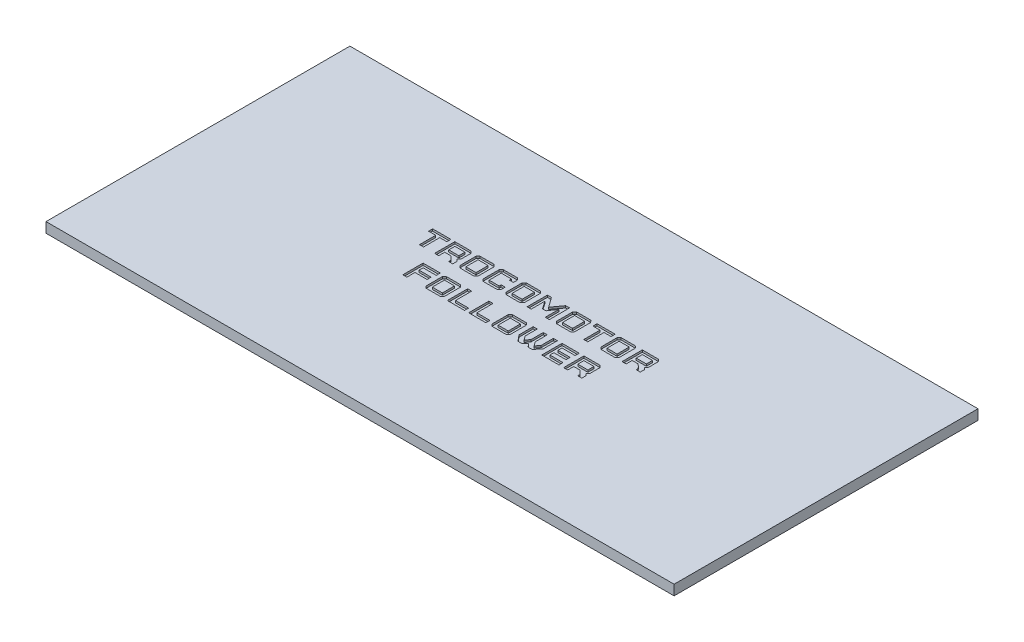
from build123d import *

# Parameters (mm, degrees)
SKETCH1_W           = 310
SKETCH1_H           = 150
BOSS_EXTRUDE1_DEPTH = 5
SKETCH2_W           = 4.98553719
SKETCH2_H           = 3.012396695
SKETCH2_H_2         = 5.995867769
SKETCH2_W_2         = 4.985537191
CUT_EXTRUDE1_DEPTH  = 1


with BuildPart() as part:
    # Sketch1 → Boss-Extrude1 (new body)
    with BuildSketch(Plane(origin=(0, 0, 0), x_dir=(1, 0, 0), z_dir=(0, 1, 0))):
        Rectangle(SKETCH1_W, SKETCH1_H)
    extrude(amount=BOSS_EXTRUDE1_DEPTH)

    # Sketch2 → Cut-Extrude1 (cut)
    # profile 1 of 18: a face of its own
    with BuildSketch(Plane(origin=(0, 5, 0), x_dir=(1, 0, 0), z_dir=(0, 1, 0))):
        Polygon((-50.972727273, 7.311112148), (-52.966528926, 7.311112148), (-52.966528926, 15.309046033), (-56.468595041, 15.309046033), (-56.468595041, 17.311112148), (-47.499586777, 17.311112148), (-47.499586777, 15.309046033), (-50.972727273, 15.309046033), align=None)
    # profile 2 of 18: a face of its own
    with BuildSketch(Plane(origin=(0, 5, 0), x_dir=(1, 0, 0), z_dir=(0, 1, 0))):
        Polygon((-36.54214876, 7.311112148), (-38.529752066, 7.311112148), (-38.529752066, 8.294583223), (-39.52768595, 9.313178264), (-40.531818182, 10.296649338), (-43.515289256, 10.296649338), (-43.515289256, 7.311112148), (-45.517355372, 7.311112148), (-45.517355372, 17.311112148), (-37.531818182, 17.311112148), (-36.54214876, 16.292517107), (-36.54214876, 11.292517107), (-37.531818182, 10.296649338), (-36.54214876, 9.313178264), align=None)
        with Locations((-41.022520661, 13.802847686)):
            Rectangle(SKETCH2_W, SKETCH2_H, mode=Mode.SUBTRACT)
    # profile 3 of 18: a face of its own
    with BuildSketch(Plane(origin=(0, 5, 0), x_dir=(1, 0, 0), z_dir=(0, 1, 0))):
        Polygon((-26.080578512, 7.311112148), (-33.074380165, 7.311112148), (-34.066115702, 8.294583223), (-34.066115702, 16.292517107), (-33.074380165, 17.311112148), (-26.080578512, 17.311112148), (-25.090909091, 16.292517107), (-25.090909091, 8.294583223), align=None)
        with Locations((-29.571280992, 12.311112149)):
            Rectangle(SKETCH2_W, SKETCH2_H_2, mode=Mode.SUBTRACT)
    # profile 4 of 18: a face of its own
    with BuildSketch(Plane(origin=(0, 5, 0), x_dir=(1, 0, 0), z_dir=(0, 1, 0))):
        Polygon((-14.629338843, 7.311112148), (-21.623140496, 7.311112148), (-22.614876033, 8.294583223), (-22.614876033, 16.292517107), (-21.623140496, 17.311112148), (-14.629338843, 17.311112148), (-13.639669421, 16.292517107), (-13.639669421, 14.313178264), (-15.627272727, 14.313178264), (-15.627272727, 15.309046033), (-20.612809917, 15.309046033), (-20.612809917, 9.313178264), (-15.627272727, 9.313178264), (-15.627272727, 10.296649338), (-13.639669421, 10.296649338), (-13.639669421, 8.294583223), align=None)
    # profile 5 of 18: a face of its own
    with BuildSketch(Plane(origin=(0, 5, 0), x_dir=(1, 0, 0), z_dir=(0, 1, 0))):
        Polygon((-3.310330579, 7.311112148), (-10.304132231, 7.311112148), (-11.295867769, 8.294583223), (-11.295867769, 16.292517107), (-10.304132231, 17.311112148), (-3.310330579, 17.311112148), (-2.320661157, 16.292517107), (-2.320661157, 8.294583223), align=None)
        with Locations((-6.801033058, 12.311112149)):
            Rectangle(SKETCH2_W, SKETCH2_H_2, mode=Mode.SUBTRACT)
    # profile 6 of 18: a face of its own
    with BuildSketch(Plane(origin=(0, 5, 0), x_dir=(1, 0, 0), z_dir=(0, 1, 0))):
        Polygon((2.157438017, 7.311112148), (0.155371901, 7.311112148), (0.155371901, 17.311112148), (2.157438017, 17.311112148), (5.642975207, 12.46400471), (9.186363636, 17.311112148), (11.109917355, 17.311112148), (11.109917355, 7.311112148), (9.109917355, 7.311112148), (9.109917355, 14.054913801), (6.502479339, 10.211938594), (4.82892562, 10.211938594), (2.157438017, 14.054913801), align=None)
    # profile 7 of 18: a face of its own
    with BuildSketch(Plane(origin=(0, 5, 0), x_dir=(1, 0, 0), z_dir=(0, 1, 0))):
        Polygon((21.575619835, 7.311112148), (14.581818182, 7.311112148), (13.590082645, 8.294583223), (13.590082645, 16.292517107), (14.581818182, 17.311112148), (21.575619835, 17.311112148), (22.565289256, 16.292517107), (22.565289256, 8.294583223), align=None)
        with Locations((18.084917355, 12.311112149)):
            Rectangle(SKETCH2_W, SKETCH2_H_2, mode=Mode.SUBTRACT)
    # profile 8 of 18: a face of its own
    with BuildSketch(Plane(origin=(0, 5, 0), x_dir=(1, 0, 0), z_dir=(0, 1, 0))):
        Polygon((30.111570248, 7.311112148), (28.117768595, 7.311112148), (28.117768595, 15.309046033), (24.615702479, 15.309046033), (24.615702479, 17.311112148), (33.584710744, 17.311112148), (33.584710744, 15.309046033), (30.111570248, 15.309046033), align=None)
    # profile 9 of 18: a face of its own
    with BuildSketch(Plane(origin=(0, 5, 0), x_dir=(1, 0, 0), z_dir=(0, 1, 0))):
        Polygon((43.552479339, 7.311112148), (36.558677686, 7.311112148), (35.566942149, 8.294583223), (35.566942149, 16.292517107), (36.558677686, 17.311112148), (43.552479339, 17.311112148), (44.54214876, 16.292517107), (44.54214876, 8.294583223), align=None)
        with Locations((40.06177686, 12.311112149)):
            Rectangle(SKETCH2_W_2, SKETCH2_H_2, mode=Mode.SUBTRACT)
    # profile 10 of 18: a face of its own
    with BuildSketch(Plane(origin=(0, 5, 0), x_dir=(1, 0, 0), z_dir=(0, 1, 0))):
        Polygon((55.99338843, 7.311112148), (54.005785124, 7.311112148), (54.005785124, 8.294583223), (53.00785124, 9.313178264), (52.003719008, 10.296649338), (49.020247934, 10.296649338), (49.020247934, 7.311112148), (47.018181818, 7.311112148), (47.018181818, 17.311112148), (55.003719008, 17.311112148), (55.99338843, 16.292517107), (55.99338843, 11.292517107), (55.003719008, 10.296649338), (55.99338843, 9.313178264), align=None)
        with Locations((51.513016529, 13.802847686)):
            Rectangle(SKETCH2_W, SKETCH2_H, mode=Mode.SUBTRACT)
    # profile 11 of 18: a face of its own
    with BuildSketch(Plane(origin=(0, 5, 0), x_dir=(1, 0, 0), z_dir=(0, 1, 0))):
        Polygon((-42.192975207, -9.688887852), (-44.195041322, -9.688887852), (-44.195041322, 0.311112148), (-35.707438017, 0.311112148), (-35.707438017, -1.690953967), (-42.192975207, -1.690953967), (-42.192975207, -3.705416777), (-36.209504132, -3.705416777), (-36.209504132, -5.707482893), (-42.192975207, -5.707482893), align=None)
    # profile 12 of 18: a face of its own
    with BuildSketch(Plane(origin=(0, 5, 0), x_dir=(1, 0, 0), z_dir=(0, 1, 0))):
        Polygon((-25.683884298, -9.688887852), (-32.67768595, -9.688887852), (-33.669421488, -8.705416777), (-33.669421488, -0.707482893), (-32.67768595, 0.311112148), (-25.683884298, 0.311112148), (-24.694214876, -0.707482893), (-24.694214876, -8.705416777), align=None)
        with Locations((-29.174586777, -4.688887852)):
            Rectangle(SKETCH2_W, SKETCH2_H_2, mode=Mode.SUBTRACT)
    # profile 13 of 18: a face of its own
    with BuildSketch(Plane(origin=(0, 5, 0), x_dir=(1, 0, 0), z_dir=(0, 1, 0))):
        Polygon((-22.218181818, 0.311112148), (-20.216115702, 0.311112148), (-20.216115702, -7.686821736), (-13.730578512, -7.686821736), (-13.730578512, -9.688887852), (-22.218181818, -9.688887852), align=None)
    # profile 14 of 18: a face of its own
    with BuildSketch(Plane(origin=(0, 5, 0), x_dir=(1, 0, 0), z_dir=(0, 1, 0))):
        Polygon((-11.692561983, 0.311112148), (-9.690495868, 0.311112148), (-9.690495868, -7.686821736), (-3.204958678, -7.686821736), (-3.204958678, -9.688887852), (-11.692561983, -9.688887852), align=None)
    # profile 15 of 18: a face of its own
    with BuildSketch(Plane(origin=(0, 5, 0), x_dir=(1, 0, 0), z_dir=(0, 1, 0))):
        Polygon((6.818595041, -9.688887852), (-0.175206612, -9.688887852), (-1.166942149, -8.705416777), (-1.166942149, -0.707482893), (-0.175206612, 0.311112148), (6.818595041, 0.311112148), (7.808264463, -0.707482893), (7.808264463, -8.705416777), align=None)
        with Locations((3.327892562, -4.688887852)):
            Rectangle(SKETCH2_W, SKETCH2_H_2, mode=Mode.SUBTRACT)
    # profile 16 of 18: a face of its own
    with BuildSketch(Plane(origin=(0, 5, 0), x_dir=(1, 0, 0), z_dir=(0, 1, 0))):
        Polygon((17.641735537, -9.688887852), (16.129338843, -7.903763885), (14.643801653, -9.688887852), (12.641735537, -9.688887852), (10.145867769, -6.703350662), (10.145867769, 0.311112148), (12.145867769, 0.311112148), (12.145867769, -5.707482893), (13.660330579, -7.686821736), (15.131404959, -5.707482893), (15.131404959, 0.311112148), (17.125206612, 0.311112148), (17.125206612, -5.707482893), (18.639669421, -7.686821736), (20.123140496, -5.707482893), (20.123140496, 0.311112148), (22.110743802, 0.311112148), (22.110743802, -6.703350662), (19.643801653, -9.688887852), align=None)
    # profile 17 of 18: a face of its own
    with BuildSketch(Plane(origin=(0, 5, 0), x_dir=(1, 0, 0), z_dir=(0, 1, 0))):
        Polygon((32.867768595, -9.688887852), (24.380165289, -9.688887852), (24.380165289, 0.311112148), (32.867768595, 0.311112148), (32.867768595, -1.690953967), (26.382231405, -1.690953967), (26.382231405, -3.705416777), (32.365702479, -3.705416777), (32.365702479, -5.707482893), (26.382231405, -5.707482893), (26.382231405, -7.686821736), (32.867768595, -7.686821736), align=None)
    # profile 18 of 18: a face of its own
    with BuildSketch(Plane(origin=(0, 5, 0), x_dir=(1, 0, 0), z_dir=(0, 1, 0))):
        Polygon((44.145454545, -9.688887852), (42.15785124, -9.688887852), (42.15785124, -8.705416777), (41.159917355, -7.686821736), (40.155785124, -6.703350662), (37.17231405, -6.703350662), (37.17231405, -9.688887852), (35.170247934, -9.688887852), (35.170247934, 0.311112148), (43.155785124, 0.311112148), (44.145454545, -0.707482893), (44.145454545, -5.707482893), (43.155785124, -6.703350662), (44.145454545, -7.686821736), align=None)
        with Locations((39.665082645, -3.197152315)):
            Rectangle(SKETCH2_W, SKETCH2_H, mode=Mode.SUBTRACT)
    extrude(amount=-CUT_EXTRUDE1_DEPTH, mode=Mode.SUBTRACT)


solid = part.part
